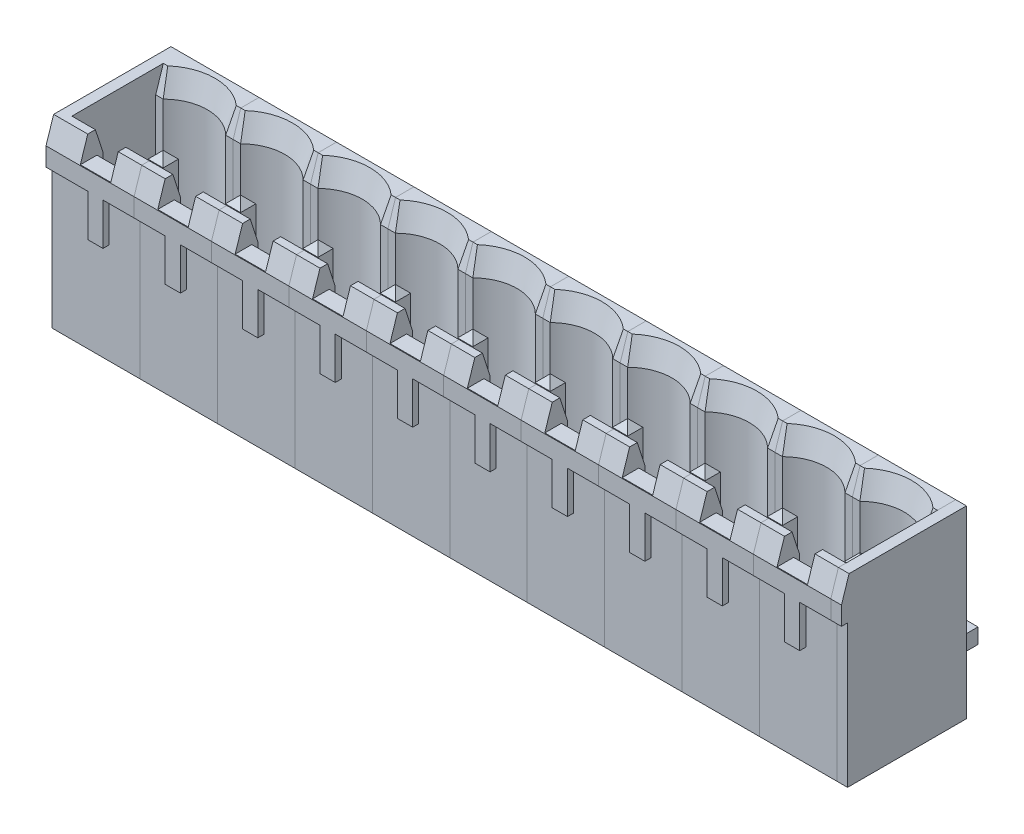
from build123d import *
from OCP.BRepFilletAPI import BRepFilletAPI_MakeChamfer

# Parameters (mm, degrees)
SKETCH_1_W             = 5.08
SKETCH_1_H             = 12.1
EXTRUDE_1_DEPTH        = 8.2
CUT_EXTRUDE_1_DEPTH    = 8.7
SKETCH_3_R             = 1.2
EXTRUDE_2_DEPTH        = 2
FILLET_1_R             = 0.25
CHAMFER_1_SIZE         = 0.5
CHAMFER_1_SIZE2        = 1.538841769
SKETCH_4_W             = 2
SKETCH_4_H             = 1.010953213
CUT_EXTRUDE_2_DEPTH    = 4.75
SKETCH_5_W             = 2
SKETCH_5_H             = 1.705458635
CUT_EXTRUDE_3_DEPTH    = 1.5
CHAMFER_2_SIZE         = 0.5
CHAMFER_2_SIZE2        = 1.538841769
SKETCH_6_W             = 5.08
SKETCH_6_H             = 6.6
CUT_EXTRUDE_4_DEPTH    = 0.4
SKETCH_7_W             = 2.04
SKETCH_7_H             = 2.75
CUT_EXTRUDE_5_DEPTH    = 0.4
EXTRUDE_1_2_DEPTH      = 0.5
EXTRUDE_1_2_DEPTH_BACK = 0.5
CHAMFER_3_SIZE         = 0.5
SKETCH_9_W             = 1
SKETCH_9_H             = 2.1
SKETCH_9_W_2           = 1.04
CUT_EXTRUDE_6_DEPTH    = 6
PATTERN_LINEAR_1_COUNT = 10
PATTERN_LINEAR_1_PITCH = 5.08
EXTRUDE_3_DEPTH        = 0.7
EXTRUDE_4_DEPTH        = 0.7
MOVE_BODY_1_ANGLE      = 180


with BuildPart() as part:
    # Эскиз1 → Extrude 1 (new body)
    with BuildSketch(Plane(origin=(0, 0, 0), x_dir=(1, 0, 0), z_dir=(0, 1, 0))):
        Rectangle(SKETCH_1_W, SKETCH_1_H)
    extrude(amount=EXTRUDE_1_DEPTH)

    # Эскиз2 → Вырез-Вытянуть1 (cut)
    with BuildSketch(Plane.XY.offset(6.05)):
        with BuildLine():
            Line((-2.54, 6.7), (2.54, 6.7))
            Line((2.54, 6.7), (2.54, 1.7))
            Line((2.54, 1.7), (2.05121915, 1.7))
            ThreePointArc((2.05121915, 1.7), (0, 0.85), (-2.05121915, 1.7))
            Line((-2.05121915, 1.7), (-2.54, 1.7))
            Line((-2.54, 1.7), (-2.54, 6.7))
        make_face()
    extrude(amount=-CUT_EXTRUDE_1_DEPTH, mode=Mode.SUBTRACT)

    # Эскиз3 → Бобышка-Вытянуть2 (add)
    with BuildSketch(Plane.XY.offset(-2.65)):
        with Locations((0, 3.75)):
            Circle(SKETCH_3_R)
    extrude(amount=EXTRUDE_2_DEPTH)

    # Скругление1
    fillet_1_edges = [part.edges().sort_by_distance(p)[0] for p in [
        (-1.2, 3.75, -0.65),
    ]]
    fillet(fillet_1_edges, radius=FILLET_1_R)

    # Фаска1: one chamfer whose edges measure the first distance from different faces: ONE call of the kernel's chamfer builder (chamfer() names one face for all edges)
    chamfer_1_edges_1 = [part.edges().sort_by_distance(p)[0] for p in [
        (0, 6.7, 6.05),
    ]]
    chamfer_1_side_1 = [part.faces().sort_by_distance(p)[0] for p in [
        (0, 7.45, 6.05),
    ]]
    chamfer_1_edges_2 = [part.edges().sort_by_distance(p)[0] for p in [
        (2.295609575, 1.7, 6.05),
        (-2.295609575, 1.7, 6.05),
        (0, 0.85, 6.05),
    ]]
    chamfer_1_side_2 = [part.faces().sort_by_distance(p)[0] for p in [
        (0, 0.655214235, 6.05),
    ]]
    chamfer_1 = BRepFilletAPI_MakeChamfer(part.part.solid().wrapped)
    for e in chamfer_1_edges_1:
        chamfer_1.Add(CHAMFER_1_SIZE, CHAMFER_1_SIZE2, e.wrapped, chamfer_1_side_1[0].wrapped)  # the first distance lies on this face
    for e in chamfer_1_edges_2:
        chamfer_1.Add(CHAMFER_1_SIZE, CHAMFER_1_SIZE2, e.wrapped, chamfer_1_side_2[0].wrapped)  # the first distance lies on this face
    add(Compound.cast(chamfer_1.Shape()), mode=Mode.REPLACE)

    # Эскиз4 → Вырез-Вытянуть2 (cut)
    with BuildSketch(Plane.XY.offset(6.05)):
        with Locations((0, 6.594523394)):
            Rectangle(SKETCH_4_W, SKETCH_4_H)
    extrude(amount=-CUT_EXTRUDE_2_DEPTH, mode=Mode.SUBTRACT)

    # Эскиз5 → Вырез-Вытянуть3 (cut)
    with BuildSketch(Plane.XY.offset(6.05)):
        with Locations((0, 7.552729318)):
            Rectangle(SKETCH_5_W, SKETCH_5_H)
    extrude(amount=-CUT_EXTRUDE_3_DEPTH, mode=Mode.SUBTRACT)

    # Фаска2
    chamfer_2_edges = [part.edges().sort_by_distance(p)[0] for p in [
        (-1.77, 8.2, 6.05),
    ]]
    chamfer_2_side = [part.faces().sort_by_distance(p)[0] for p in [
        (-1.77, 7.7, 6.05),
    ]]
    chamfer(chamfer_2_edges, length=CHAMFER_2_SIZE, length2=CHAMFER_2_SIZE2, reference=chamfer_2_side[0])

    # Эскиз6 → Вырез-Вытянуть4 (cut)
    with BuildSketch(Plane(origin=(0, 8.2, 0), x_dir=(1, 0, 0), z_dir=(0, 1, 0))):
        with Locations((0, 2.75)):
            Rectangle(SKETCH_6_W, SKETCH_6_H)
    extrude(amount=-CUT_EXTRUDE_4_DEPTH, mode=Mode.SUBTRACT)

    # Эскиз7 → Вырез-Вытянуть5 (cut)
    with BuildSketch(Plane(origin=(0, 8.2, 0), x_dir=(1, 0, 0), z_dir=(0, 1, 0))):
        with Locations((1.52, -1.925)):
            Rectangle(SKETCH_7_W, SKETCH_7_H)
        with Locations((-1.52, -1.925)):
            Rectangle(SKETCH_7_W, SKETCH_7_H)
    extrude(amount=-CUT_EXTRUDE_5_DEPTH, mode=Mode.SUBTRACT)

    # Эскиз9 → Вырез-Вытянуть6 (cut)
    with BuildSketch(Plane.XZ):
        with Locations((0, -5)):
            Rectangle(SKETCH_9_W, SKETCH_9_H)
        with Locations((-2.02, -5)):
            Rectangle(SKETCH_9_W_2, SKETCH_9_H)
        with Locations((2.02, -5)):
            Rectangle(SKETCH_9_W_2, SKETCH_9_H)
    extrude(amount=-CUT_EXTRUDE_6_DEPTH, mode=Mode.SUBTRACT)


with BuildPart() as body_2:
    # Эскиз8 → Extrude 1 2 (new, two sides: drawn at the far end of the back side and taken through both)
    with BuildSketch(Plane(origin=(0, 0, 0), x_dir=(0, 0, -1), z_dir=(1, 0, 0)).offset(-EXTRUDE_1_2_DEPTH_BACK)):
        with BuildLine():
            Line((-3.65, 3.25), (3.95, 3.25))
            Line((3.95, 3.25), (3.95, -4))
            Line((3.95, -4), (4.95, -4))
            Line((4.95, -4), (4.95, 3.25))
            ThreePointArc((4.95, 3.25), (4.657106781, 3.957106781), (3.95, 4.25))
            Line((3.95, 4.25), (-3.65, 4.25))
            Line((-3.65, 4.25), (-3.65, 3.25))
        make_face()
    extrude(amount=EXTRUDE_1_2_DEPTH + EXTRUDE_1_2_DEPTH_BACK)

    # Фаска3
    chamfer_3_edges = [body_2.edges().sort_by_distance(p)[0] for p in [
        (0, 3.25, 3.65),
        (0, 4.25, 3.65),
        (0, -4, -4.95),
        (0, -4, -3.95),
        (0.5, -4, -4.45),
        (0.5, 3.75, 3.65),
        (-0.5, 3.75, 3.65),
        (-0.5, -4, -4.45),
    ]]
    chamfer(chamfer_3_edges, length=CHAMFER_3_SIZE - 0.0001)  # a hair under: the kernel refuses the full size


with BuildPart() as pattern_linear_1_1:
    # Линейный массив1: pattern copy
    add(body_2.part.moved(Location(Vector(-1, 0, 0) * (1 * PATTERN_LINEAR_1_PITCH))))


with BuildPart() as pattern_linear_1_2:
    # Линейный массив1: pattern copy
    add(body_2.part.moved(Location(Vector(-1, 0, 0) * (2 * PATTERN_LINEAR_1_PITCH))))


with BuildPart() as pattern_linear_1_3:
    # Линейный массив1: pattern copy
    add(body_2.part.moved(Location(Vector(-1, 0, 0) * (3 * PATTERN_LINEAR_1_PITCH))))


with BuildPart() as pattern_linear_1_4:
    # Линейный массив1: pattern copy
    add(body_2.part.moved(Location(Vector(-1, 0, 0) * (4 * PATTERN_LINEAR_1_PITCH))))


with BuildPart() as pattern_linear_1_5:
    # Линейный массив1: pattern copy
    add(body_2.part.moved(Location(Vector(-1, 0, 0) * (5 * PATTERN_LINEAR_1_PITCH))))


with BuildPart() as pattern_linear_1_6:
    # Линейный массив1: pattern copy
    add(body_2.part.moved(Location(Vector(-1, 0, 0) * (6 * PATTERN_LINEAR_1_PITCH))))


with BuildPart() as pattern_linear_1_7:
    # Линейный массив1: pattern copy
    add(body_2.part.moved(Location(Vector(-1, 0, 0) * (7 * PATTERN_LINEAR_1_PITCH))))


with BuildPart() as pattern_linear_1_8:
    # Линейный массив1: pattern copy
    add(body_2.part.moved(Location(Vector(-1, 0, 0) * (8 * PATTERN_LINEAR_1_PITCH))))


with BuildPart() as pattern_linear_1_9:
    # Линейный массив1: pattern copy
    add(body_2.part.moved(Location(Vector(-1, 0, 0) * (9 * PATTERN_LINEAR_1_PITCH))))


with BuildPart() as pattern_linear_1_10:
    # Линейный массив1: pattern copy
    add(part.part.moved(Location(Vector(-1, 0, 0) * (1 * PATTERN_LINEAR_1_PITCH))))


with BuildPart() as pattern_linear_1_11:
    # Линейный массив1: pattern copy
    add(part.part.moved(Location(Vector(-1, 0, 0) * (2 * PATTERN_LINEAR_1_PITCH))))


with BuildPart() as pattern_linear_1_12:
    # Линейный массив1: pattern copy
    add(part.part.moved(Location(Vector(-1, 0, 0) * (3 * PATTERN_LINEAR_1_PITCH))))


with BuildPart() as pattern_linear_1_13:
    # Линейный массив1: pattern copy
    add(part.part.moved(Location(Vector(-1, 0, 0) * (4 * PATTERN_LINEAR_1_PITCH))))


with BuildPart() as pattern_linear_1_14:
    # Линейный массив1: pattern copy
    add(part.part.moved(Location(Vector(-1, 0, 0) * (5 * PATTERN_LINEAR_1_PITCH))))


with BuildPart() as pattern_linear_1_15:
    # Линейный массив1: pattern copy
    add(part.part.moved(Location(Vector(-1, 0, 0) * (6 * PATTERN_LINEAR_1_PITCH))))


with BuildPart() as pattern_linear_1_16:
    # Линейный массив1: pattern copy
    add(part.part.moved(Location(Vector(-1, 0, 0) * (7 * PATTERN_LINEAR_1_PITCH))))


with BuildPart() as pattern_linear_1_17:
    # Линейный массив1: pattern copy
    add(part.part.moved(Location(Vector(-1, 0, 0) * (8 * PATTERN_LINEAR_1_PITCH))))


with BuildPart() as pattern_linear_1_18:
    # Линейный массив1: pattern copy
    add(part.part.moved(Location(Vector(-1, 0, 0) * (9 * PATTERN_LINEAR_1_PITCH))))


with BuildPart() as part_1:
    add(part.part)

    # Эскиз10 → Бобышка-Вытянуть3 (add)
    with BuildSketch(Plane(origin=(2.54, 0, 0), x_dir=(0, 0, -1), z_dir=(1, 0, 0))):
        Polygon((6.05, 7.8), (-3.3, 7.8), (-3.3, 8.2), (-4.511158231, 8.2), (-6.05, 7.7), (-6.05, 0), (6.05, 0), align=None)
    extrude(amount=EXTRUDE_3_DEPTH)


with BuildPart() as body_21:
    # Эскиз11 → Бобышка-Вытянуть4 (new body)
    with BuildSketch(Plane.ZY.offset(48.26)):
        Polygon((-6.05, 7.8), (-6.05, 0), (6.05, 0), (6.05, 7.7), (4.511158231, 8.2), (3.3, 8.2), (3.3, 7.8), align=None)
    extrude(amount=EXTRUDE_4_DEPTH)


with BuildPart() as body_2_1:
    # Move Body 1: moved
    add(body_2.part.rotate(Axis((0, 0, 0), (0, 0.7071067811865488, 0.7071067811865462)), MOVE_BODY_1_ANGLE))


with BuildPart() as pattern_linear_1_1_1:
    # Move Body 1: moved
    add(pattern_linear_1_1.part.rotate(Axis((0, 0, 0), (0, 0.7071067811865488, 0.7071067811865462)), MOVE_BODY_1_ANGLE))


with BuildPart() as pattern_linear_1_10_1:
    # Move Body 1: moved
    add(pattern_linear_1_10.part.rotate(Axis((0, 0, 0), (0, 0.7071067811865488, 0.7071067811865462)), MOVE_BODY_1_ANGLE))


with BuildPart() as pattern_linear_1_11_1:
    # Move Body 1: moved
    add(pattern_linear_1_11.part.rotate(Axis((0, 0, 0), (0, 0.7071067811865488, 0.7071067811865462)), MOVE_BODY_1_ANGLE))


with BuildPart() as pattern_linear_1_12_1:
    # Move Body 1: moved
    add(pattern_linear_1_12.part.rotate(Axis((0, 0, 0), (0, 0.7071067811865488, 0.7071067811865462)), MOVE_BODY_1_ANGLE))


with BuildPart() as pattern_linear_1_2_1:
    # Move Body 1: moved
    add(pattern_linear_1_2.part.rotate(Axis((0, 0, 0), (0, 0.7071067811865488, 0.7071067811865462)), MOVE_BODY_1_ANGLE))


with BuildPart() as pattern_linear_1_3_1:
    # Move Body 1: moved
    add(pattern_linear_1_3.part.rotate(Axis((0, 0, 0), (0, 0.7071067811865488, 0.7071067811865462)), MOVE_BODY_1_ANGLE))


with BuildPart() as pattern_linear_1_4_1:
    # Move Body 1: moved
    add(pattern_linear_1_4.part.rotate(Axis((0, 0, 0), (0, 0.7071067811865488, 0.7071067811865462)), MOVE_BODY_1_ANGLE))


with BuildPart() as pattern_linear_1_5_1:
    # Move Body 1: moved
    add(pattern_linear_1_5.part.rotate(Axis((0, 0, 0), (0, 0.7071067811865488, 0.7071067811865462)), MOVE_BODY_1_ANGLE))


with BuildPart() as pattern_linear_1_6_1:
    # Move Body 1: moved
    add(pattern_linear_1_6.part.rotate(Axis((0, 0, 0), (0, 0.7071067811865488, 0.7071067811865462)), MOVE_BODY_1_ANGLE))


with BuildPart() as pattern_linear_1_7_1:
    # Move Body 1: moved
    add(pattern_linear_1_7.part.rotate(Axis((0, 0, 0), (0, 0.7071067811865488, 0.7071067811865462)), MOVE_BODY_1_ANGLE))


with BuildPart() as pattern_linear_1_8_1:
    # Move Body 1: moved
    add(pattern_linear_1_8.part.rotate(Axis((0, 0, 0), (0, 0.7071067811865488, 0.7071067811865462)), MOVE_BODY_1_ANGLE))


with BuildPart() as pattern_linear_1_9_1:
    # Move Body 1: moved
    add(pattern_linear_1_9.part.rotate(Axis((0, 0, 0), (0, 0.7071067811865488, 0.7071067811865462)), MOVE_BODY_1_ANGLE))


with BuildPart() as pattern_linear_1_13_1:
    # Move Body 1: moved
    add(pattern_linear_1_13.part.rotate(Axis((0, 0, 0), (0, 0.7071067811865488, 0.7071067811865462)), MOVE_BODY_1_ANGLE))


with BuildPart() as pattern_linear_1_14_1:
    # Move Body 1: moved
    add(pattern_linear_1_14.part.rotate(Axis((0, 0, 0), (0, 0.7071067811865488, 0.7071067811865462)), MOVE_BODY_1_ANGLE))


with BuildPart() as pattern_linear_1_15_1:
    # Move Body 1: moved
    add(pattern_linear_1_15.part.rotate(Axis((0, 0, 0), (0, 0.7071067811865488, 0.7071067811865462)), MOVE_BODY_1_ANGLE))


with BuildPart() as pattern_linear_1_16_1:
    # Move Body 1: moved
    add(pattern_linear_1_16.part.rotate(Axis((0, 0, 0), (0, 0.7071067811865488, 0.7071067811865462)), MOVE_BODY_1_ANGLE))


with BuildPart() as pattern_linear_1_17_1:
    # Move Body 1: moved
    add(pattern_linear_1_17.part.rotate(Axis((0, 0, 0), (0, 0.7071067811865488, 0.7071067811865462)), MOVE_BODY_1_ANGLE))


with BuildPart() as pattern_linear_1_18_1:
    # Move Body 1: moved
    add(pattern_linear_1_18.part.rotate(Axis((0, 0, 0), (0, 0.7071067811865488, 0.7071067811865462)), MOVE_BODY_1_ANGLE))


with BuildPart() as part_2:
    # Move Body 1: moved
    add(part_1.part.rotate(Axis((0, 0, 0), (0, 0.7071067811865488, 0.7071067811865462)), MOVE_BODY_1_ANGLE))


with BuildPart() as body_21_1:
    # Move Body 1: moved
    add(body_21.part.rotate(Axis((0, 0, 0), (0, 0.7071067811865488, 0.7071067811865462)), MOVE_BODY_1_ANGLE))


with BuildPart() as body_21_2:
    # Move Body 2: read off the stored shape, not the designer's step
    # Move Body 2: moved
    add(body_21_1.part.moved(Location((0, 4.45, 0))))


with BuildPart() as part_3:
    # Move Body 2 2: moved
    add(part_2.part.moved(Location((0, 4.45, 0))))


with BuildPart() as pattern_linear_1_18_2:
    # Move Body 2 3: moved
    add(pattern_linear_1_18_1.part.moved(Location((0, 4.45, 0))))


with BuildPart() as pattern_linear_1_17_2:
    # Move Body 2 4: moved
    add(pattern_linear_1_17_1.part.moved(Location((0, 4.45, 0))))


with BuildPart() as pattern_linear_1_16_2:
    # Move Body 2 5: moved
    add(pattern_linear_1_16_1.part.moved(Location((0, 4.45, 0))))


with BuildPart() as pattern_linear_1_15_2:
    # Move Body 2 6: moved
    add(pattern_linear_1_15_1.part.moved(Location((0, 4.45, 0))))


with BuildPart() as pattern_linear_1_14_2:
    # Move Body 2 7: moved
    add(pattern_linear_1_14_1.part.moved(Location((0, 4.45, 0))))


with BuildPart() as pattern_linear_1_13_2:
    # Move Body 2 8: moved
    add(pattern_linear_1_13_1.part.moved(Location((0, 4.45, 0))))


with BuildPart() as pattern_linear_1_9_2:
    # Move Body 2 9: moved
    add(pattern_linear_1_9_1.part.moved(Location((0, 4.45, 0))))


with BuildPart() as pattern_linear_1_8_2:
    # Move Body 2 10: moved
    add(pattern_linear_1_8_1.part.moved(Location((0, 4.45, 0))))


with BuildPart() as pattern_linear_1_7_2:
    # Move Body 2 11: moved
    add(pattern_linear_1_7_1.part.moved(Location((0, 4.45, 0))))


with BuildPart() as pattern_linear_1_6_2:
    # Move Body 2 12: moved
    add(pattern_linear_1_6_1.part.moved(Location((0, 4.45, 0))))


with BuildPart() as pattern_linear_1_5_2:
    # Move Body 2 13: moved
    add(pattern_linear_1_5_1.part.moved(Location((0, 4.45, 0))))


with BuildPart() as pattern_linear_1_4_2:
    # Move Body 2 14: moved
    add(pattern_linear_1_4_1.part.moved(Location((0, 4.45, 0))))


with BuildPart() as pattern_linear_1_3_2:
    # Move Body 2 15: moved
    add(pattern_linear_1_3_1.part.moved(Location((0, 4.45, 0))))


with BuildPart() as pattern_linear_1_2_2:
    # Move Body 2 16: moved
    add(pattern_linear_1_2_1.part.moved(Location((0, 4.45, 0))))


with BuildPart() as pattern_linear_1_12_2:
    # Move Body 2 17: moved
    add(pattern_linear_1_12_1.part.moved(Location((0, 4.45, 0))))


with BuildPart() as pattern_linear_1_11_2:
    # Move Body 2 18: moved
    add(pattern_linear_1_11_1.part.moved(Location((0, 4.45, 0))))


with BuildPart() as pattern_linear_1_10_2:
    # Move Body 2 19: moved
    add(pattern_linear_1_10_1.part.moved(Location((0, 4.45, 0))))


with BuildPart() as pattern_linear_1_1_2:
    # Move Body 2 20: moved
    add(pattern_linear_1_1_1.part.moved(Location((0, 4.45, 0))))


with BuildPart() as body_2_2:
    # Move Body 2 21: moved
    add(body_2_1.part.moved(Location((0, 4.45, 0))))


solid = Compound([body_21_2.part, part_3.part, pattern_linear_1_18_2.part, pattern_linear_1_17_2.part, pattern_linear_1_16_2.part, pattern_linear_1_15_2.part, pattern_linear_1_14_2.part, pattern_linear_1_13_2.part, pattern_linear_1_9_2.part, pattern_linear_1_8_2.part, pattern_linear_1_7_2.part, pattern_linear_1_6_2.part, pattern_linear_1_5_2.part, pattern_linear_1_4_2.part, pattern_linear_1_3_2.part, pattern_linear_1_2_2.part, pattern_linear_1_12_2.part, pattern_linear_1_11_2.part, pattern_linear_1_10_2.part, pattern_linear_1_1_2.part, body_2_2.part])
